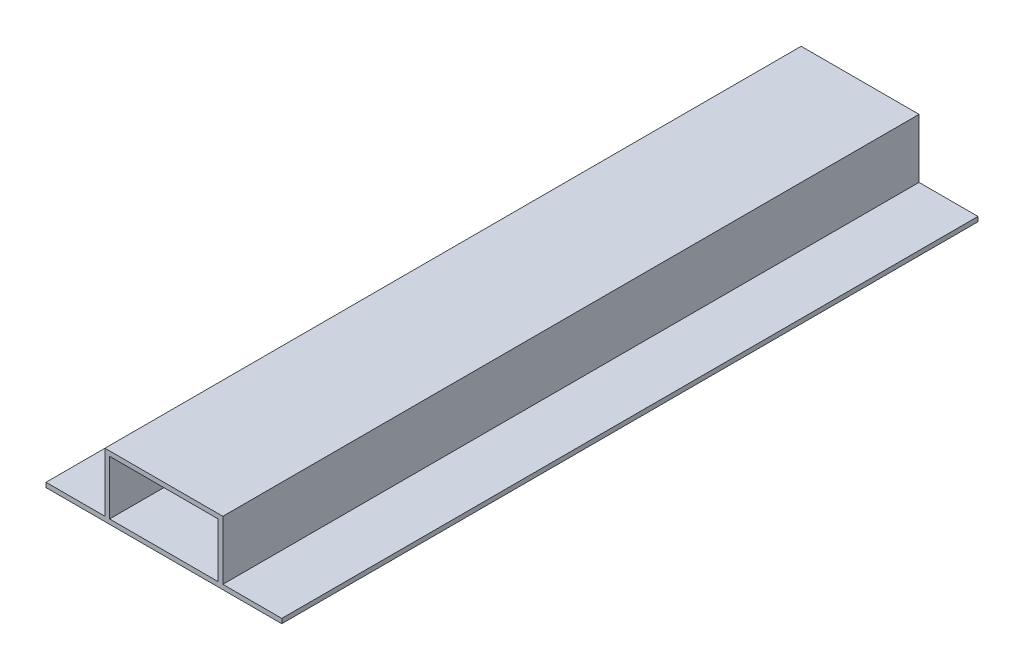
from build123d import *

# Parameters (mm, degrees)
SALIENTE_EXTRUIR1_DEPTH = 75


with BuildPart() as part:
    # Croquis1 → Saliente-Extruir1 (new, symmetric)
    with BuildSketch(Plane.XY):
        Polygon((12.7, 13.7), (0, 13.7), (-12.7, 13.7), (-12.7, 1), (-25.4, 1), (-25.4, 0), (25.4, 0), (25.4, 1), (12.7, 1), align=None)
        Polygon((-11.7, 12.7), (0, 12.7), (11.7, 12.7), (11.7, 1), (-11.7, 1), align=None, mode=Mode.SUBTRACT)
    extrude(amount=SALIENTE_EXTRUIR1_DEPTH, both=True)


solid = part.part
